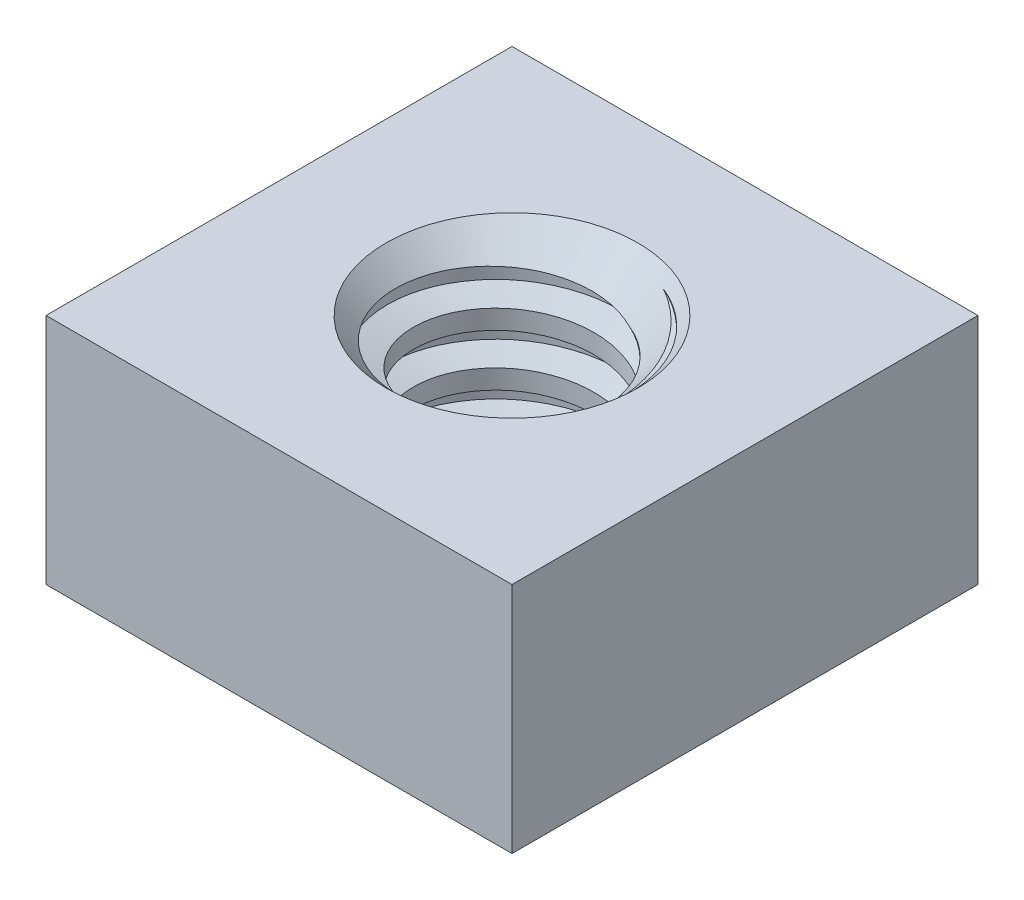
from build123d import *

# Parameters (mm, degrees)
SKETCH1_W           = 19.05
SKETCH1_H           = 19.05
SKETCH1_R           = 4.7625
BOSS_EXTRUDE1_DEPTH = 4.7625
SWEEP1_PITCH        = 2.116666667
SKETCH4_R           = 5.1435
CUT_EXTRUDE1_DEPTH  = 18.803973303
SKETCH5_R           = 5.1435
CUT_EXTRUDE2_DEPTH  = 17.497784115


with BuildPart() as part:
    # Sketch1 → Boss-Extrude1 (new, symmetric)
    with BuildSketch(Plane(origin=(0, 0, 0), x_dir=(1, 0, 0), z_dir=(0, 1, 0))):
        Rectangle(SKETCH1_W, SKETCH1_H)
        with Locations(Location((0, 0, 0), (0, 0, 90))):
            Circle(SKETCH1_R, mode=Mode.SUBTRACT)
    extrude(amount=BOSS_EXTRUDE1_DEPTH, both=True)

    # Sweep1: the profile of Sketch3 profile screwed along a right-hand helix of 5.5 turns, 10 arcs to a turn; built about Z, then put on its axis
    sweep1_z = Axis((0, 0, 0), (0, 0, 1))
    sweep1_corners = [(4.7628, 0, 7.7585e-05), (3.704238627, 0, -0.273685), (3.704238627, 0, -1.058333333), (4.7628, 0, -1.332095919)]
    with BuildLine(mode=Mode.PRIVATE) as sweep1_profile:
        Line(sweep1_corners[0], sweep1_corners[1])
        Line(sweep1_corners[1], sweep1_corners[2])
        Line(sweep1_corners[2], sweep1_corners[3])
        Line(sweep1_corners[3], sweep1_corners[0])
    sweep1_cap = Face(sweep1_profile.wire())
    sweep1_turn_angles = [0, 18, 36, 54, 72, 90, 108, 126, 144, 162, 180, 198, 216, 234, 252, 270, 288, 306, 324, 342, 360]
    sweep1_turn_weights = [1, 0.9510565162951535, 1, 0.9510565162951535, 1, 0.9510565162951535, 1, 0.9510565162951535, 1, 0.9510565162951535, 1, 0.9510565162951535, 1, 0.9510565162951535, 1, 0.9510565162951535, 1, 0.9510565162951535, 1, 0.9510565162951535, 1]
    sweep1_turn_rails = [Edge.make_bspline([Vector(p[0], p[1], 0).rotate(sweep1_z, sweep1_turn_angles[k]) / sweep1_turn_weights[k] + Vector(0, 0, p[2] + SWEEP1_PITCH * sweep1_turn_angles[k] / 360) for k in range(21)], [0, 0, 0, 1, 1, 2, 2, 3, 3, 4, 4, 5, 5, 6, 6, 7, 7, 8, 8, 9, 9, 10, 10, 10], 2, sweep1_turn_weights) for p in sweep1_corners]
    sweep1_turn_sides = [Face.make_surface_from_curves(sweep1_turn_rails[p[0]], sweep1_turn_rails[p[1]]) for p in [(0, 1), (1, 2), (2, 3), (3, 0)]]
    sweep1_last_angles = [1800, 1818, 1836, 1854, 1872, 1890, 1908, 1926, 1944, 1962, 1980]
    sweep1_last_weights = [1, 0.9510565162951535, 1, 0.9510565162951535, 1, 0.9510565162951535, 1, 0.9510565162951535, 1, 0.9510565162951358, 1]
    sweep1_last_rails = [Edge.make_bspline([Vector(p[0], p[1], 0).rotate(sweep1_z, sweep1_last_angles[k]) / sweep1_last_weights[k] + Vector(0, 0, p[2] + SWEEP1_PITCH * sweep1_last_angles[k] / 360) for k in range(11)], [0, 0, 0, 1, 1, 2, 2, 3, 3, 4, 4, 5, 5, 5], 2, sweep1_last_weights) for p in sweep1_corners]
    sweep1_last_sides = [Face.make_surface_from_curves(sweep1_last_rails[p[0]], sweep1_last_rails[p[1]]) for p in [(0, 1), (1, 2), (2, 3), (3, 0)]]
    sweep1 = Plane(origin=(0, 4.7625, 0), x_dir=(1, 0, 0), z_dir=(0, -1, 0)) * Solid(Shell([*[p.moved(Location((0, 0, SWEEP1_PITCH * i))) for i in range(5) for p in sweep1_turn_sides], *sweep1_last_sides, sweep1_cap, sweep1_cap.rotate(sweep1_z, 1980).moved(Location((0, 0, SWEEP1_PITCH * 1980 / 360)))]))
    add(sweep1)

    # Sketch4 → Cut-Extrude1 (cut, through all)
    with BuildSketch(Plane(origin=(0, 4.7625, 0), x_dir=(1, 0, 0), z_dir=(0, 1, 0))):
        Circle(SKETCH4_R)
    extrude(amount=CUT_EXTRUDE1_DEPTH, mode=Mode.SUBTRACT)

    # Sketch5 → Cut-Extrude2 (cut, through all)
    with BuildSketch(Plane.XZ.offset(4.7625)):
        Circle(SKETCH5_R)
    extrude(amount=CUT_EXTRUDE2_DEPTH, mode=Mode.SUBTRACT)

    # Cut-Extrude3 cone 1 section (through the dimple's axis) → Cut-Extrude3 (revolve, cut)
    with BuildSketch(Plane(origin=(0, 4.7625, 0), x_dir=(0, 0, 1), z_dir=(1, 0, 0))):
        Polygon((0, 0), (5.1435, 0), (0, 5.1435), align=None)
    revolve(axis=Axis((0, 4.7625, 0), (0, -1, 0)), mode=Mode.SUBTRACT)

    # Cut-Extrude4 cone 1 section (through the dimple's axis) → Cut-Extrude4 (revolve, cut)
    with BuildSketch(Plane(origin=(0, -4.7625, 0), x_dir=(0, 0, -1), z_dir=(1, 0, 0))):
        Polygon((0, 0), (5.1435, 0), (0, 5.1435), align=None)
    revolve(axis=Axis((0, -4.7625, 0), (0, 1, 0)), mode=Mode.SUBTRACT)


solid = part.part
